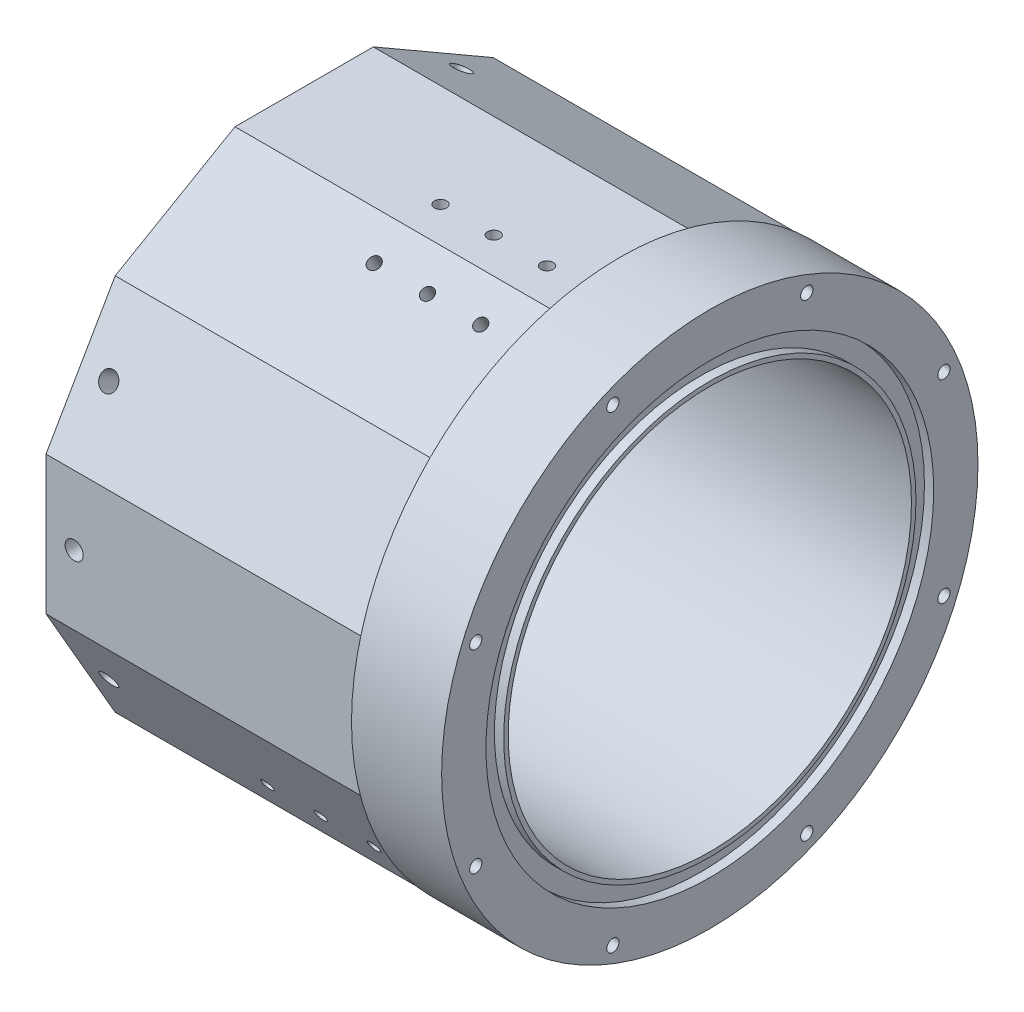
from build123d import *

# Parameters (mm, degrees)
F_8_32_TAPPED_HOLE1_D          = 3.4544
F_8_32_TAPPED_HOLE1_DEPTH      = 9.672193539
F_8_32_TAPPED_HOLE1_TIP        = 1.037806461
CUT_EXTRUDE1_START             = -88.9
CUT_EXTRUDE1_OUTLINE_R         = 75.565
CUT_EXTRUDE1_DEPTH             = 88.9
CIRPATTERN1_COUNT              = 4
CIRPATTERN1_ANGLE              = 90
F_8_32_TAPPED_HOLE2_AT_2_COUNT = 2
F_8_32_TAPPED_HOLE2_AT_2_PITCH = 15
F_8_32_TAPPED_HOLE2_AT_3_COUNT = 2
F_8_32_TAPPED_HOLE2_AT_3_PITCH = 30
CIRPATTERN2_COUNT              = 3
F_8_32_TAPPED_HOLE3_AT_2_COUNT = 2
F_8_32_TAPPED_HOLE3_AT_2_PITCH = 15
F_8_32_TAPPED_HOLE3_AT_3_COUNT = 2
F_8_32_TAPPED_HOLE3_AT_3_PITCH = 30
F_8_32_TAPPED_HOLE4_D          = 3.4544
F_8_32_TAPPED_HOLE4_DEPTH      = 6.962193539
F_8_32_TAPPED_HOLE4_TIP        = 1.037806461


# Read off the part's stored shape, not the designer's step: Cut-Extrude1
with BuildPart() as part:
    # Sketch2 → Revolve1 (revolve)
    with BuildSketch(Plane(origin=(0, 0, 0), x_dir=(1, 0, 0), z_dir=(0, 1, 0)), mode=Mode.PRIVATE) as revolve1_sk:
        Polygon((0, 0), (0, -75.565), (114.3, -75.565), (114.3, -63.085807371), (111.69015, -63.085807371), (111.69015, -58.085736), (114.3, -58.085736), (114.3, -56.815736), (15.875, -56.815736), (15.875, 0), align=None)
    revolve(revolve1_sk.sketch.rotate(Axis((15.875, 0, 0), (-1, 0, 0)), 180), axis=Axis((15.875, 0, 0), (-1, 0, 0)))

    # #8-32 Tapped Hole1
    with Locations(Plane(origin=(114.3, 65.952711024, 27.318507381), x_dir=(0, 0, 1), z_dir=(1, 0, 0))):
        with Locations((0, 0), (-54.637014762, 0), (-93.271218405, 38.634203643), (-93.271218405, 93.271218405), (-54.637014762, 131.905422048), (0, 131.905422048), (38.634203643, 93.271218405), (38.634203643, 38.634203643)):
            Hole(F_8_32_TAPPED_HOLE1_D / 2, depth=F_8_32_TAPPED_HOLE1_DEPTH)
            with Locations((0, 0, -(F_8_32_TAPPED_HOLE1_DEPTH + F_8_32_TAPPED_HOLE1_TIP / 2))):  # 118° drill point
                Cone(0, F_8_32_TAPPED_HOLE1_D / 2, F_8_32_TAPPED_HOLE1_TIP, mode=Mode.SUBTRACT)

    # Cut-Extrude1 outline → Cut-Extrude1 (cut)
    with BuildSketch(Plane.ZY.offset(CUT_EXTRUDE1_START)):
        Circle(CUT_EXTRUDE1_OUTLINE_R)
        Polygon((72.744839904, 19.491921106), (72.744839904, -19.491921106), (53.252918798, -53.252918798), (19.491921106, -72.744839904), (-19.491921106, -72.744839904), (-53.252918798, -53.252918798), (-72.744839904, -19.491921106), (-72.744839904, 19.491921106), (-53.252918798, 53.252918798), (-19.491921106, 72.744839904), (19.491921106, 72.744839904), (53.252918798, 53.252918798), align=None, mode=Mode.SUBTRACT)
    extrude(amount=CUT_EXTRUDE1_DEPTH, mode=Mode.SUBTRACT)

    # Sketch7 → 1/4-20 Tapped Hole1 (revolve, cut)
    with BuildSketch(Plane(origin=(7.9375, 36.372419952, 62.998879351), x_dir=(0, -0.8660254037844386, 0.5000000000000002), z_dir=(1, 0, 0))):
        Polygon((0, 0), (0, 25.4), (2.5527, 23.866183098), (2.5527, 0), align=None)
    f_1_4_20_tapped_hole1 = revolve(axis=Axis((7.9375, 39.547419952, 68.498140665), (0, -0.5000000000000002, -0.8660254037844386)), mode=Mode.SUBTRACT)

    # CirPattern1: 1/4-20 Tapped Hole1 ×4 about axis
    cirpattern1_axis = Axis((15.875, 0, 0), (1, 0, 0))
    for i in range(1, CIRPATTERN1_COUNT):
        add(f_1_4_20_tapped_hole1.rotate(cirpattern1_axis, i * CIRPATTERN1_ANGLE / (CIRPATTERN1_COUNT - 1)), mode=Mode.SUBTRACT)

    # Mirror1: 1/4-20 Tapped Hole1 across plane
    add(f_1_4_20_tapped_hole1.mirror(Plane(origin=(0, 0, 0), x_dir=(1, 0, 0), z_dir=(0, -0.25881904510252035, 0.9659258262890684))), mode=Mode.SUBTRACT)

    # Mirror1 copy 1 sketch → Mirror1 copy 1 (revolve, cut)
    with BuildSketch(Plane(origin=(7.9375, 36.372419952, -62.998879351), x_dir=(0, -0.8660254037844396, -0.49999999999999845), z_dir=(1, 0, 0))):
        Polygon((0, 0), (0, -25.4), (2.5527, -23.866183098), (2.5527, 0), align=None)
    revolve(axis=Axis((7.9375, 39.547419952, -68.498140665), (0, 0.49999999999999845, -0.8660254037844399)), mode=Mode.SUBTRACT)

    # Mirror1 copy 2 sketch → Mirror1 copy 2 (revolve, cut)
    with BuildSketch(Plane(origin=(7.9375, 0, -72.744839904), x_dir=(0, -1, 0), z_dir=(1, 0, 0))):
        Polygon((0, 0), (0, -25.4), (2.5527, -23.866183098), (2.5527, 0), align=None)
    revolve(axis=Axis((7.9375, 0, -79.094839904), (0, 0, -1)), mode=Mode.SUBTRACT)

    # Mirror1 copy 3 sketch → Mirror1 copy 3 (revolve, cut)
    with BuildSketch(Plane(origin=(7.9375, -36.372419952, -62.998879351), x_dir=(0, -0.8660254037844366, 0.500000000000004), z_dir=(1, 0, 0))):
        Polygon((0, 0), (0, -25.4), (2.5527, -23.866183098), (2.5527, 0), align=None)
    revolve(axis=Axis((7.9375, -39.547419952, -68.498140665), (0, -0.5000000000000038, -0.8660254037844367)), mode=Mode.SUBTRACT)

    # Sketch10 → #8-32 Tapped Hole2 (revolve, cut)
    with BuildSketch(Plane(origin=(47.9, 67.744839904, 28.152175144), x_dir=(0, -0.49999999999999967, 0.8660254037844388), z_dir=(1, 0, 0))):
        Polygon((0, 0), (0, 8), (1.7272, 6.962193539), (1.7272, 0), align=None)
    f_8_32_tapped_hole2 = revolve(axis=Axis((47.9, 73.244101218, 31.327175144), (0, -0.8660254037844389, -0.49999999999999967)), mode=Mode.SUBTRACT)

    # #8-32 Tapped Hole2 at 2: #8-32 Tapped Hole2 ×2
    with Locations(*[(i * F_8_32_TAPPED_HOLE2_AT_2_PITCH, 0, 0) for i in range(1, F_8_32_TAPPED_HOLE2_AT_2_COUNT)]):
        add(f_8_32_tapped_hole2, mode=Mode.SUBTRACT)

    # #8-32 Tapped Hole2 at 3: #8-32 Tapped Hole2 ×2
    with Locations(*[(i * F_8_32_TAPPED_HOLE2_AT_3_PITCH, 0, 0) for i in range(1, F_8_32_TAPPED_HOLE2_AT_3_COUNT)]):
        add(f_8_32_tapped_hole2, mode=Mode.SUBTRACT)

    # Mirror2: #8-32 Tapped Hole2 across plane
    add(f_8_32_tapped_hole2.mirror(Plane(origin=(0, 0, 0), x_dir=(1, 0, 0), z_dir=(0, -0.25881904510252035, 0.9659258262890684))), mode=Mode.SUBTRACT)

    # Mirror2 copy 1 sketch → Mirror2 copy 1 (revolve, cut)
    with BuildSketch(Plane(origin=(62.9, 72.744839904, 9.491921106), x_dir=(0, 0, -1), z_dir=(1, 0, 0))):
        Polygon((0, 0), (0, -8), (1.7272, -6.962193539), (1.7272, 0), align=None)
    revolve(axis=Axis((62.9, 79.094839904, 9.491921106), (0, 1, 0)), mode=Mode.SUBTRACT)

    # Mirror2 copy 2 sketch → Mirror2 copy 2 (revolve, cut)
    with BuildSketch(Plane(origin=(77.9, 72.744839904, 9.491921106), x_dir=(0, 0, -1), z_dir=(1, 0, 0))):
        Polygon((0, 0), (0, -8), (1.7272, -6.962193539), (1.7272, 0), align=None)
    revolve(axis=Axis((77.9, 79.094839904, 9.491921106), (0, 1, 0)), mode=Mode.SUBTRACT)

    # CirPattern2: #8-32 Tapped Hole2 ×3 about axis
    cirpattern2_axis = Axis((15.875, 0, 0), (1, 0, 0))
    for i in range(1, CIRPATTERN2_COUNT):
        add(f_8_32_tapped_hole2.rotate(cirpattern2_axis, i * 360 / CIRPATTERN2_COUNT), mode=Mode.SUBTRACT)

    # CirPattern2 copy 1 sketch → CirPattern2 copy 1 (revolve, cut)
    with BuildSketch(Plane(origin=(62.9, -58.252918798, 44.59266476), x_dir=(0, -0.5000000000000004, -0.8660254037844384), z_dir=(1, 0, 0))):
        Polygon((0, 0), (0, 8), (1.7272, 6.962193539), (1.7272, 0), align=None)
    revolve(axis=Axis((62.9, -63.752180112, 47.76766476), (0, 0.8660254037844384, -0.5000000000000006)), mode=Mode.SUBTRACT)

    # CirPattern2 copy 2 sketch → CirPattern2 copy 2 (revolve, cut)
    with BuildSketch(Plane(origin=(62.9, -9.491921106, -72.744839904), x_dir=(0, 1, 0), z_dir=(1, 0, 0))):
        Polygon((0, 0), (0, 8), (1.7272, 6.962193539), (1.7272, 0), align=None)
    revolve(axis=Axis((62.9, -9.491921106, -79.094839904), (0, 0, 1)), mode=Mode.SUBTRACT)

    # CirPattern2 copy 3 sketch → CirPattern2 copy 3 (revolve, cut)
    with BuildSketch(Plane(origin=(77.9, -58.252918798, 44.59266476), x_dir=(0, -0.5000000000000004, -0.8660254037844384), z_dir=(1, 0, 0))):
        Polygon((0, 0), (0, 8), (1.7272, 6.962193539), (1.7272, 0), align=None)
    revolve(axis=Axis((77.9, -63.752180112, 47.76766476), (0, 0.8660254037844384, -0.5000000000000006)), mode=Mode.SUBTRACT)

    # CirPattern2 copy 4 sketch → CirPattern2 copy 4 (revolve, cut)
    with BuildSketch(Plane(origin=(77.9, -9.491921106, -72.744839904), x_dir=(0, 1, 0), z_dir=(1, 0, 0))):
        Polygon((0, 0), (0, 8), (1.7272, 6.962193539), (1.7272, 0), align=None)
    revolve(axis=Axis((77.9, -9.491921106, -79.094839904), (0, 0, 1)), mode=Mode.SUBTRACT)

    # CirPattern2 copy 5 sketch → CirPattern2 copy 5 (revolve, cut)
    with BuildSketch(Plane(origin=(47.9, -44.59266476, 58.252918798), x_dir=(0, 0.866025403784439, 0.4999999999999995), z_dir=(1, 0, 0))):
        Polygon((0, 0), (0, -8), (1.7272, -6.962193539), (1.7272, 0), align=None)
    revolve(axis=Axis((47.9, -47.76766476, 63.752180112), (0, -0.49999999999999944, 0.866025403784439)), mode=Mode.SUBTRACT)

    # CirPattern2 copy 6 sketch → CirPattern2 copy 6 (revolve, cut)
    with BuildSketch(Plane(origin=(47.9, -28.152175144, -67.744839904), x_dir=(0, -0.8660254037844384, 0.5000000000000009), z_dir=(1, 0, 0))):
        Polygon((0, 0), (0, -8), (1.7272, -6.962193539), (1.7272, 0), align=None)
    revolve(axis=Axis((47.9, -31.327175144, -73.244101218), (0, -0.5000000000000009, -0.8660254037844383)), mode=Mode.SUBTRACT)

    # CirPattern2 copy 7 sketch → CirPattern2 copy 7 (revolve, cut)
    with BuildSketch(Plane(origin=(62.9, -44.59266476, 58.252918798), x_dir=(0, 0.866025403784439, 0.4999999999999995), z_dir=(1, 0, 0))):
        Polygon((0, 0), (0, -8), (1.7272, -6.962193539), (1.7272, 0), align=None)
    revolve(axis=Axis((62.9, -47.76766476, 63.752180112), (0, -0.49999999999999944, 0.866025403784439)), mode=Mode.SUBTRACT)

    # CirPattern2 copy 8 sketch → CirPattern2 copy 8 (revolve, cut)
    with BuildSketch(Plane(origin=(62.9, -28.152175144, -67.744839904), x_dir=(0, -0.8660254037844384, 0.5000000000000009), z_dir=(1, 0, 0))):
        Polygon((0, 0), (0, -8), (1.7272, -6.962193539), (1.7272, 0), align=None)
    revolve(axis=Axis((62.9, -31.327175144, -73.244101218), (0, -0.5000000000000009, -0.8660254037844383)), mode=Mode.SUBTRACT)

    # CirPattern2 copy 9 sketch → CirPattern2 copy 9 (revolve, cut)
    with BuildSketch(Plane(origin=(77.9, -44.59266476, 58.252918798), x_dir=(0, 0.866025403784439, 0.4999999999999995), z_dir=(1, 0, 0))):
        Polygon((0, 0), (0, -8), (1.7272, -6.962193539), (1.7272, 0), align=None)
    revolve(axis=Axis((77.9, -47.76766476, 63.752180112), (0, -0.49999999999999944, 0.866025403784439)), mode=Mode.SUBTRACT)

    # CirPattern2 copy 10 sketch → CirPattern2 copy 10 (revolve, cut)
    with BuildSketch(Plane(origin=(77.9, -28.152175144, -67.744839904), x_dir=(0, -0.8660254037844384, 0.5000000000000009), z_dir=(1, 0, 0))):
        Polygon((0, 0), (0, -8), (1.7272, -6.962193539), (1.7272, 0), align=None)
    revolve(axis=Axis((77.9, -31.327175144, -73.244101218), (0, -0.5000000000000009, -0.8660254037844383)), mode=Mode.SUBTRACT)

    # Sketch12 → #8-32 Tapped Hole3 (revolve, cut)
    with BuildSketch(Plane(origin=(77.9, -49.069286721, -55.668339904), x_dir=(0, 0.8660254037844386, -0.5000000000000002), z_dir=(1, 0, 0))):
        Polygon((0, 0), (0, 8), (1.7272, 6.962193539), (1.7272, 0), align=None)
    f_8_32_tapped_hole3 = revolve(axis=Axis((77.9, -52.244286721, -61.167601218), (0, 0.5000000000000001, 0.8660254037844386)), mode=Mode.SUBTRACT)

    # #8-32 Tapped Hole3 at 2: #8-32 Tapped Hole3 ×2
    with Locations(*[(-i * F_8_32_TAPPED_HOLE3_AT_2_PITCH, 0, 0) for i in range(1, F_8_32_TAPPED_HOLE3_AT_2_COUNT)]):
        add(f_8_32_tapped_hole3, mode=Mode.SUBTRACT)

    # #8-32 Tapped Hole3 at 3: #8-32 Tapped Hole3 ×2
    with Locations(*[(-i * F_8_32_TAPPED_HOLE3_AT_3_PITCH, 0, 0) for i in range(1, F_8_32_TAPPED_HOLE3_AT_3_COUNT)]):
        add(f_8_32_tapped_hole3, mode=Mode.SUBTRACT)

    # Mirror3: #8-32 Tapped Hole3 across plane
    add(f_8_32_tapped_hole3.mirror(Plane(origin=(0, 0, 0), x_dir=(1, 0, 0), z_dir=(0, -0.25881904510252035, 0.9659258262890684))), mode=Mode.SUBTRACT)

    # Mirror3 copy 1 sketch → Mirror3 copy 1 (revolve, cut)
    with BuildSketch(Plane(origin=(62.9, -70.329418798, 23.675553182), x_dir=(0, 0.5000000000000006, 0.8660254037844385), z_dir=(1, 0, 0))):
        Polygon((0, 0), (0, -8), (1.7272, -6.962193539), (1.7272, 0), align=None)
    revolve(axis=Axis((62.9, -75.828680112, 26.850553182), (0, -0.8660254037844384, 0.5000000000000008)), mode=Mode.SUBTRACT)

    # Mirror3 copy 2 sketch → Mirror3 copy 2 (revolve, cut)
    with BuildSketch(Plane(origin=(47.9, -70.329418798, 23.675553182), x_dir=(0, 0.5000000000000006, 0.8660254037844385), z_dir=(1, 0, 0))):
        Polygon((0, 0), (0, -8), (1.7272, -6.962193539), (1.7272, 0), align=None)
    revolve(axis=Axis((47.9, -75.828680112, 26.850553182), (0, -0.8660254037844384, 0.5000000000000008)), mode=Mode.SUBTRACT)

    # #8-32 Tapped Hole4
    with Locations(Plane.ZY):
        with Locations((-40.505358218, -56.472550541), (6.842393935, -69.159342494)):
            Hole(F_8_32_TAPPED_HOLE4_D / 2, depth=F_8_32_TAPPED_HOLE4_DEPTH)
            with Locations((0, 0, -(F_8_32_TAPPED_HOLE4_DEPTH + F_8_32_TAPPED_HOLE4_TIP / 2))):  # 118° drill point
                Cone(0, F_8_32_TAPPED_HOLE4_D / 2, F_8_32_TAPPED_HOLE4_TIP, mode=Mode.SUBTRACT)


solid = part.part
